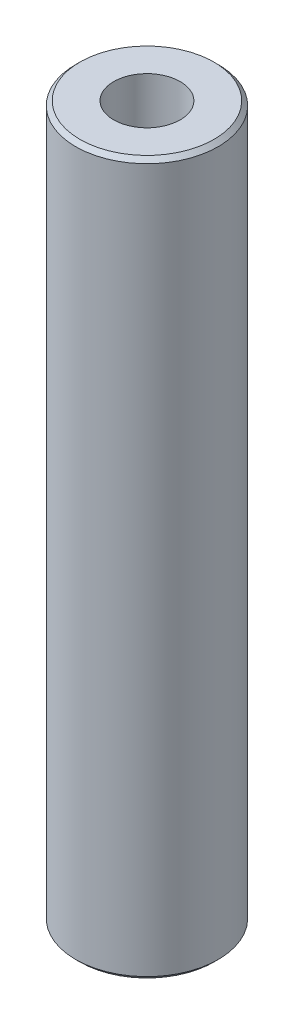
from build123d import *

# Parameters (mm, degrees)
SKETCH1_R           = 60
BOSS_EXTRUDE1_DEPTH = 600
SKETCH2_R           = 27.981775468
CUT_EXTRUDE1_DEPTH  = 606.970296302
CHAMFER1_SIZE       = 3.547512972


with BuildPart() as part:
    # Sketch1 → Boss-Extrude1 (new body)
    with BuildSketch(Plane(origin=(0, 0, 0), x_dir=(1, 0, 0), z_dir=(0, 1, 0))):
        Circle(SKETCH1_R)
    extrude(amount=BOSS_EXTRUDE1_DEPTH)

    # Sketch2 → Cut-Extrude1 (cut, through all)
    with BuildSketch(Plane(origin=(0, 0, 0), x_dir=(1, 0, 0), z_dir=(0, 1, 0))):
        Circle(SKETCH2_R)
    extrude(amount=CUT_EXTRUDE1_DEPTH, mode=Mode.SUBTRACT)

    # Chamfer1
    chamfer1_edges = [part.edges().sort_by_distance(p)[0] for p in [
        (-60, 600, 0),
        (-60, 0, 0),
    ]]
    chamfer(chamfer1_edges, length=CHAMFER1_SIZE)


solid = part.part
